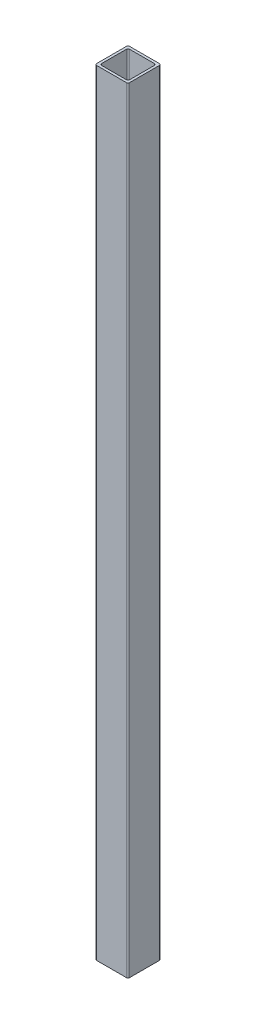
from build123d import *

# Parameters (mm, degrees)
BOSS_EXTRUDE1_DEPTH = 470


with BuildPart() as part:
    # Sketch1 → Boss-Extrude1 (new body)
    with BuildSketch(Plane(origin=(0, 0, 0), x_dir=(1, 0, 0), z_dir=(0, 1, 0))):
        with BuildLine():
            Line((-9, -10), (9, -10))
            ThreePointArc((9, -10), (9.707106781, -9.707106781), (10, -9))
            Line((10, -9), (10, 9))
            ThreePointArc((10, 9), (9.707106781, 9.707106781), (9, 10))
            Line((9, 10), (-9, 10))
            ThreePointArc((-9, 10), (-9.707106781, 9.707106781), (-10, 9))
            Line((-10, 9), (-10, -9))
            ThreePointArc((-10, -9), (-9.707106781, -9.707106781), (-9, -10))
        make_face()
        with BuildLine():
            Line((-7.5, -8.5), (7.5, -8.5))
            ThreePointArc((7.5, -8.5), (8.207106781, -8.207106781), (8.5, -7.5))
            Line((8.5, -7.5), (8.5, 7.5))
            ThreePointArc((8.5, 7.5), (8.207106781, 8.207106781), (7.5, 8.5))
            Line((7.5, 8.5), (-7.5, 8.5))
            ThreePointArc((-7.5, 8.5), (-8.207106781, 8.207106781), (-8.5, 7.5))
            Line((-8.5, 7.5), (-8.5, -7.5))
            ThreePointArc((-8.5, -7.5), (-8.207106781, -8.207106781), (-7.5, -8.5))
        make_face(mode=Mode.SUBTRACT)
    extrude(amount=BOSS_EXTRUDE1_DEPTH)


solid = part.part
